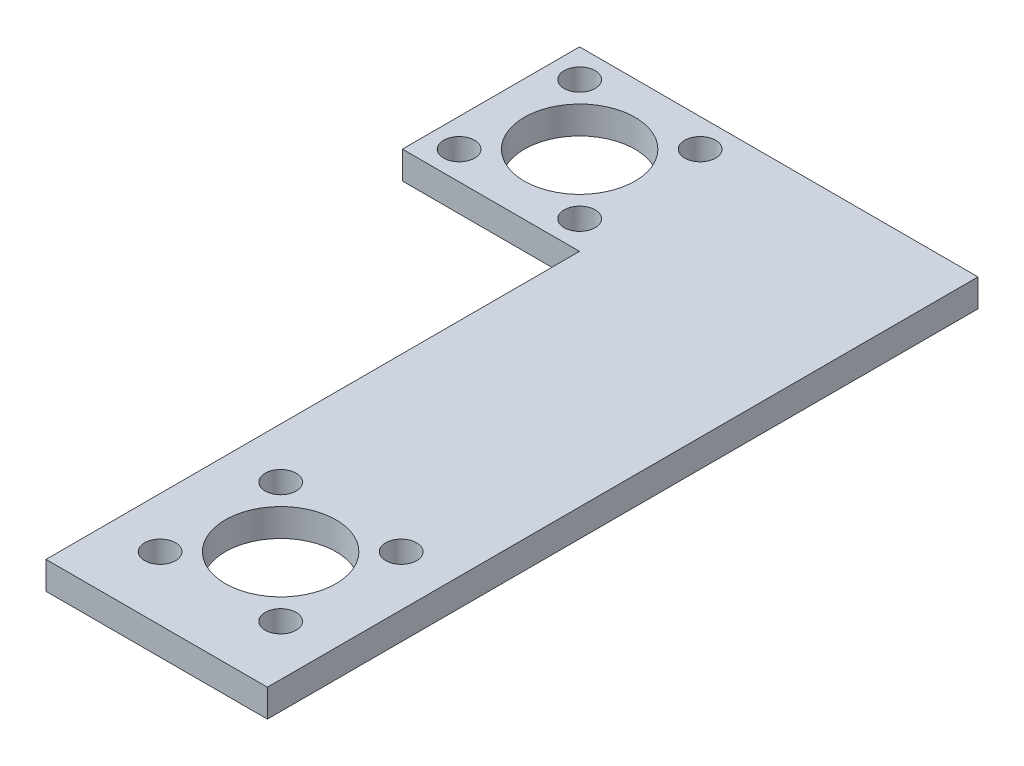
from build123d import *

# Parameters (mm, degrees)
BOSS_EXTRUDE1_DEPTH = 3.175
SKETCH2_R           = 1.778
SKETCH2_R_2         = 6.35
CUT_EXTRUDE1_DEPTH  = 3.175
SKETCH7_R           = 6.35
SKETCH7_R_2         = 1.778
CUT_EXTRUDE3_DEPTH  = 3.175


with BuildPart() as part:
    # Sketch1 → Boss-Extrude1 (new body)
    with BuildSketch(Plane(origin=(0, 0, 0), x_dir=(1, 0, 0), z_dir=(0, 1, 0))):
        Polygon((0, 0), (-45.72, 0), (-45.72, -20.32), (-25.4, -20.32), (-25.4, -81.534), (0, -81.534), align=None)
    extrude(amount=BOSS_EXTRUDE1_DEPTH)

    # Sketch2 → Cut-Extrude1 (cut)
    with BuildSketch(Plane(origin=(0, 3.175, 0), x_dir=(1, 0, 0), z_dir=(0, 1, 0))):
        with Locations((-42.459555136, -3.245202787)):
            Circle(SKETCH2_R)
        with Locations((-28.62996071, -3.245202787)):
            Circle(SKETCH2_R)
        with Locations((-28.62996071, -17.074797213)):
            Circle(SKETCH2_R)
        with Locations((-42.459555136, -17.074797213)):
            Circle(SKETCH2_R)
        with Locations((-35.544757923, -10.16)):
            Circle(SKETCH2_R_2)
    extrude(amount=-CUT_EXTRUDE1_DEPTH, mode=Mode.SUBTRACT)

    # Sketch7 → Cut-Extrude3 (cut)
    with BuildSketch(Plane(origin=(0, 3.175, 0), x_dir=(1, 0, 0), z_dir=(0, 1, 0))):
        with Locations((-12.7, -67.31)):
            Circle(SKETCH7_R)
        with Locations((-5.785202787, -60.395202787)):
            Circle(SKETCH7_R_2)
        with Locations((-5.785202787, -74.224797213)):
            Circle(SKETCH7_R_2)
        with Locations((-19.614797213, -74.224797213)):
            Circle(SKETCH7_R_2)
        with Locations((-19.614797213, -60.395202787)):
            Circle(SKETCH7_R_2)
    extrude(amount=-CUT_EXTRUDE3_DEPTH, mode=Mode.SUBTRACT)


solid = part.part
